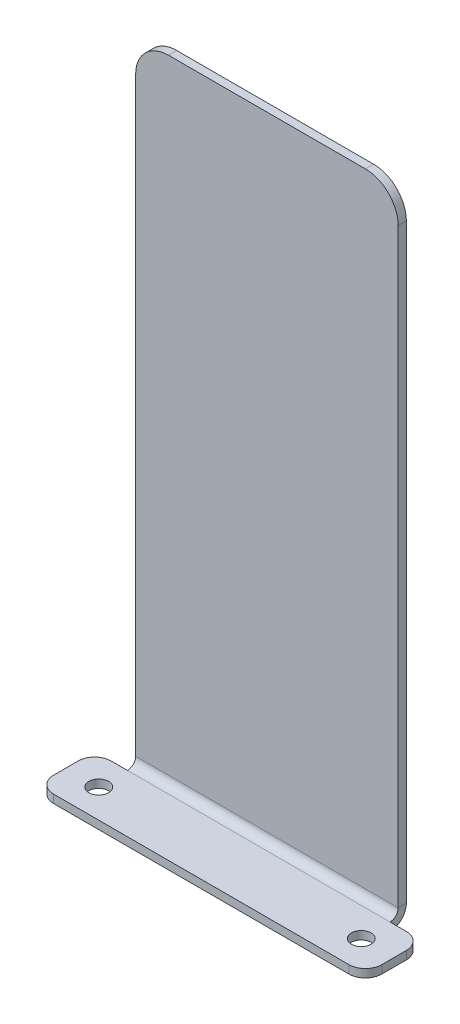
from build123d import *

# Parameters (mm, degrees)
SKETCH1_W                    = 101.6
SKETCH1_H                    = 247.65
BASE_FLANGE1_DEPTH           = 3.175
EDGE_FLANGE1_STRIP_W         = 19.05
EDGE_FLANGE1_STRIP_H         = 3.175
EDGE_FLANGE1_STRIP_CUT_DEPTH = 101.6
EDGE_FLANGE1_DEPTH           = 101.6
FILLET1_R                    = 12.7
SKETCH9_W                    = 127
SKETCH9_H                    = 22.225
BOSS_EXTRUDE1_DEPTH          = 3.175
F_1_4_CLEARANCE_HOLE1_D      = 7.62
FILLET3_R                    = 6.35


# Sheet-metal steps are written as plain solids
with BuildPart() as part:
    # Sketch1 → Base-Flange1 (new body)
    with BuildSketch(Plane.XY):
        with Locations((0, 123.825)):
            Rectangle(SKETCH1_W, SKETCH1_H)
    extrude(amount=-BASE_FLANGE1_DEPTH)

    # Edge-Flange1 strip (across the edge) → Edge-Flange1 strip cut (cut)
    with BuildSketch(Plane.YZ.offset(-50.8)):
        with Locations((-3.175, -1.5875)):
            Rectangle(EDGE_FLANGE1_STRIP_W, EDGE_FLANGE1_STRIP_H)
    extrude(amount=EDGE_FLANGE1_STRIP_CUT_DEPTH, mode=Mode.SUBTRACT)

    # Edge-Flange1 section (across the edge) → Edge-Flange1 (add)
    with BuildSketch(Plane.YZ.offset(-50.8)):
        with BuildLine():
            Line((0, 3.175), (0, 25.4))
            Line((0, 25.4), (3.175, 25.4))
            Line((3.175, 25.4), (3.175, 3.175))
            ThreePointArc((3.175, 3.175), (4.10493597, 0.92993597), (6.35, 0))
            Line((6.35, 0), (6.35, -3.175))
            ThreePointArc((6.35, -3.175), (1.859871939, -1.315128061), (0, 3.175))
        make_face()
    extrude(amount=EDGE_FLANGE1_DEPTH)

    # Fillet1
    fillet1_edges = [part.edges().sort_by_distance(p)[0] for p in [
        (-50.8, 247.65, -1.5875),
        (50.8, 247.65, -1.5875),
    ]]
    fillet(fillet1_edges, radius=FILLET1_R)

    # Sketch9 → Boss-Extrude1 (add)
    with BuildSketch(Plane(origin=(0, 3.175, 0), x_dir=(1, 0, 0), z_dir=(0, 1, 0))):
        with Locations((0, -14.2875)):
            Rectangle(SKETCH9_W, SKETCH9_H)
    extrude(amount=-BOSS_EXTRUDE1_DEPTH)

    # 1/4 Clearance Hole1 (through all)
    with Locations(Plane(origin=(0, 3.175, 0), x_dir=(1, 0, 0), z_dir=(0, 1, 0))):
        with Locations((-50.8, -14.2875), (50.8, -14.2875)):
            Hole(F_1_4_CLEARANCE_HOLE1_D / 2)

    # Fillet3
    fillet3_edges = [part.edges().sort_by_distance(p)[0] for p in [
        (-63.5, 1.5875, 3.175),
        (63.5, 1.5875, 25.4),
        (-63.5, 1.5875, 25.4),
        (63.5, 1.5875, 3.175),
    ]]
    fillet(fillet3_edges, radius=FILLET3_R)


solid = part.part
